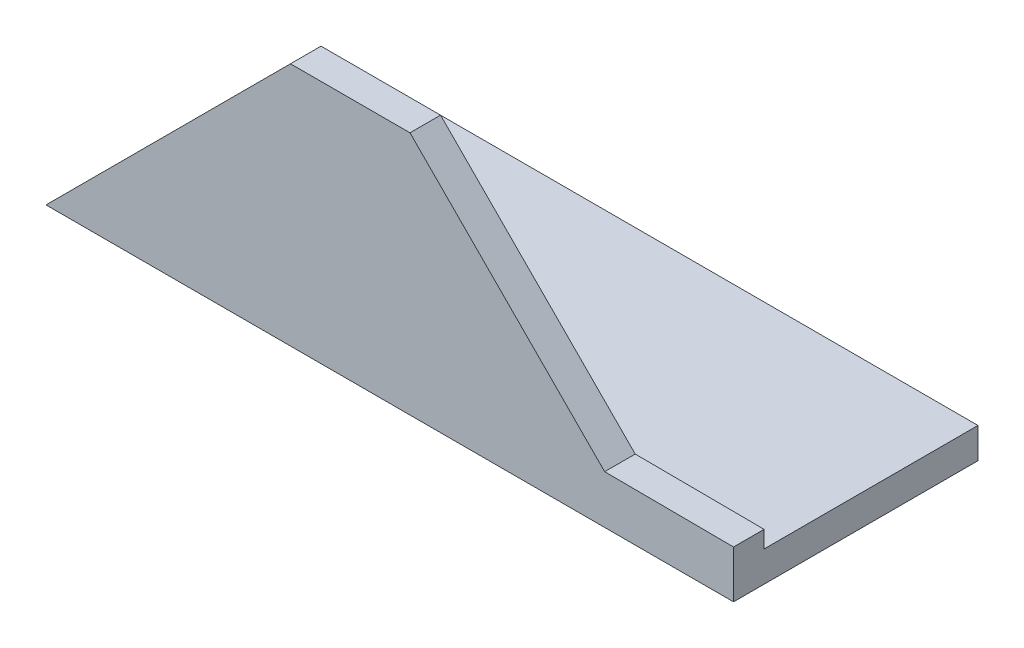
from build123d import *

# Parameters (mm, degrees)
EXTRUDE_1_DEPTH     = 90
CUT_EXTRUDE_1_DEPTH = 101.737282076


with BuildPart() as part:
    # Эскиз1 → Вытянуть-Тонкостенный1 (new body)
    with BuildSketch(Plane(origin=(0, 0, 0), x_dir=(0, 0, -1), z_dir=(1, 0, 0))):
        Polygon((0, 32), (0, 0), (32, 0), (32, 4), (4, 4), (4, 32), align=None)
    extrude(amount=EXTRUDE_1_DEPTH)

    # Эскиз2 → Вырез-Вытянуть1 (cut, through all)
    with BuildSketch(Plane.XY):
        Polygon((0, 0), (0, 32), (32, 32), align=None)
        Polygon((90, 6.221723455), (73.130290822, 6.323164906), (47.647738063, 32), (90, 32), align=None)
    extrude(amount=-CUT_EXTRUDE_1_DEPTH, mode=Mode.SUBTRACT)


solid = part.part
